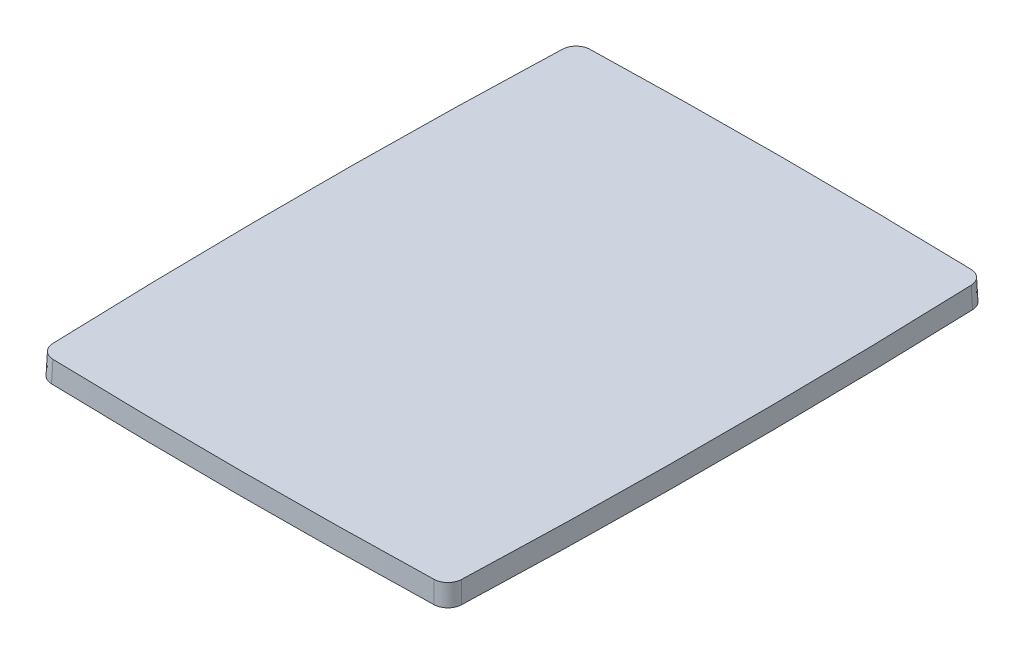
from build123d import *

# Parameters (mm, degrees)
BOSS_EXTRUDE1_DEPTH = 1.5
BOSS_EXTRUDE1_TAPER = 2
FILLET1_R           = 1


with BuildPart() as part:
    # Sketch1 → Boss-Extrude1 (new body)
    with BuildSketch(Plane(origin=(0, 0, 0), x_dir=(1, 0, 0), z_dir=(0, 1, 0))):
        with BuildLine():
            ThreePointArc((-14.437110194, 18.969844439), (-14.8, 0), (-14.437110194, -18.969844439))
            ThreePointArc((-14.437110194, -18.969844439), (0, -19.18), (14.437110194, -18.969844439))
            ThreePointArc((14.437110194, -18.969844439), (14.8, 0), (14.437110194, 18.969844439))
            ThreePointArc((14.437110194, 18.969844439), (0, 19.18), (-14.437110194, 18.969844439))
        make_face()
    extrude(amount=BOSS_EXTRUDE1_DEPTH, taper=BOSS_EXTRUDE1_TAPER)

    # Fillet1
    fillet1_edges = [part.edges().sort_by_distance(p)[0] for p in [
        (-14.411873986, 0.75, 18.944376415),
        (14.411873986, 0.75, 18.944376415),
        (14.411873986, 0.75, -18.944376415),
        (-14.411873986, 0.75, -18.944376415),
    ]]
    fillet(fillet1_edges, radius=FILLET1_R)


solid = part.part
